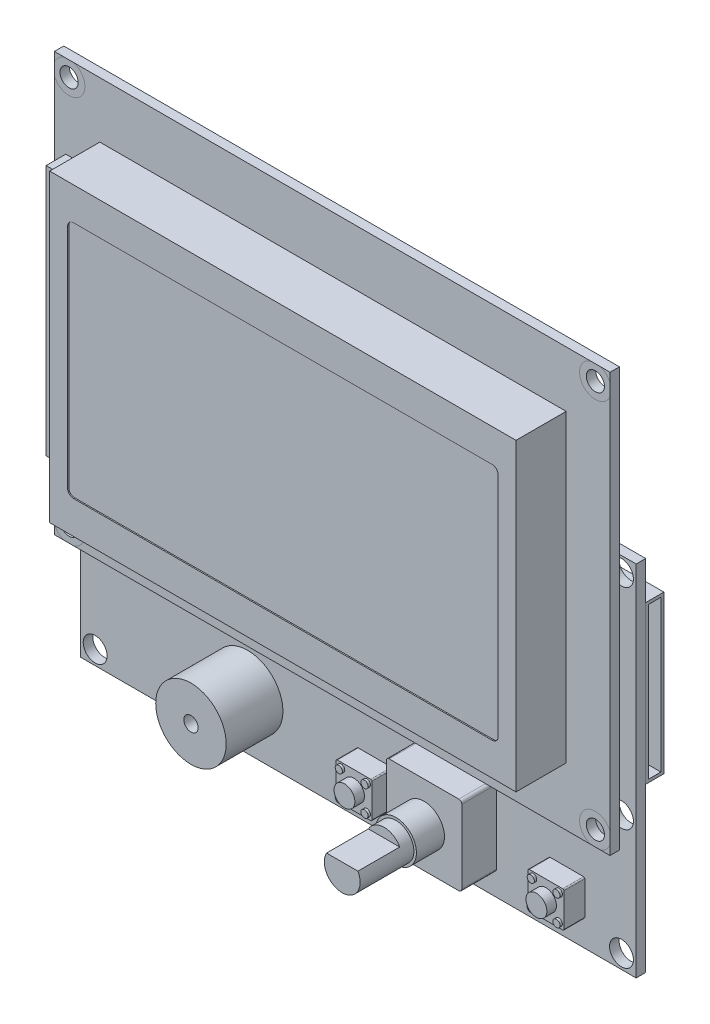
from build123d import *
from build123d.topology import SkipClean

# Parameters (mm, degrees)
SKETCH1_W            = 93.06
SKETCH1_H            = 70.1
SKETCH1_R            = 1.525
BOSS_EXTRUDE1_DEPTH  = 1.57
SKETCH2_W            = 78.1
SKETCH2_H            = 51
BOSS_EXTRUDE2_DEPTH  = 8.4
CUT_EXTRUDE1_DEPTH   = 0.2
SKETCH4_W            = 5.7
SKETCH4_H            = 42.1
BOSS_EXTRUDE3_DEPTH  = 3.3
SKETCH6_W            = 93.06
SKETCH6_H            = 60.05
BOSS_EXTRUDE4_DEPTH  = 1.6
SKETCH7_R            = 2
CUT_EXTRUDE2_DEPTH   = 1.6
BOSS_EXTRUDE5_REACH  = 118.934
SKETCH8_W            = 73.06
SKETCH8_H            = 2
SKETCH9_W            = 20.3
SKETCH9_H            = 8.75
SKETCH9_W_2          = 19.3
SKETCH9_H_2          = 7.75
BOSS_EXTRUDE6_DEPTH  = 9
BOSS_EXTRUDE7_DEPTH  = 3.05
CUT_EXTRUDE3_REACH   = 119.276
SKETCH11_W           = 2.05
SKETCH11_H           = 25.35
BOSS_EXTRUDE8_DEPTH  = 3.05
BOSS_EXTRUDE9_DEPTH  = 3.5
SKETCH15_R           = 1.75
BOSS_EXTRUDE10_DEPTH = 1.6
BOSS_EXTRUDE11_DEPTH = 5.8
SKETCH17_R           = 3.425
BOSS_EXTRUDE12_DEPTH = 4.7
BOSS_EXTRUDE13_DEPTH = 9
SKETCH19_R           = 0.6
BOSS_EXTRUDE14_DEPTH = 0.4
SKETCH21_R           = 5.9
BOSS_EXTRUDE15_DEPTH = 9.5
SKETCH22_R           = 1.2
CUT_EXTRUDE4_DEPTH   = 2
SKETCH23_R           = 3
BOSS_EXTRUDE16_DEPTH = 2


with BuildPart() as part:
    # Sketch1 → Boss-Extrude1 (new body)
    with BuildSketch(Plane.XY):
        with Locations((46.53, 35.05)):
            Rectangle(SKETCH1_W, SKETCH1_H)
        with Locations((2.455, 67.565)):
            Circle(SKETCH1_R, mode=Mode.SUBTRACT)
        with Locations((90.605, 67.565)):
            Circle(SKETCH1_R, mode=Mode.SUBTRACT)
        with Locations((90.605, 2.535)):
            Circle(SKETCH1_R, mode=Mode.SUBTRACT)
        with Locations((2.455, 2.535)):
            Circle(SKETCH1_R, mode=Mode.SUBTRACT)
    extrude(amount=BOSS_EXTRUDE1_DEPTH)

    # Sketch2 → Boss-Extrude2 (add)
    with BuildSketch(Plane.XY.offset(1.57)):
        with Locations((46.66, 35.25)):
            Rectangle(SKETCH2_W, SKETCH2_H)
    extrude(amount=BOSS_EXTRUDE2_DEPTH)

    # Sketch3 → Cut-Extrude1 (cut)
    with BuildSketch(Plane.XY.offset(9.97)):
        with BuildLine():
            Line((11.61, 55.25), (81.71, 55.25))
            ThreePointArc((81.71, 55.25), (82.417106781, 54.957106781), (82.71, 54.25))
            Line((82.71, 54.25), (82.71, 16.25))
            ThreePointArc((82.71, 16.25), (82.417106781, 15.542893219), (81.71, 15.25))
            Line((81.71, 15.25), (11.61, 15.25))
            ThreePointArc((11.61, 15.25), (10.902893219, 15.542893219), (10.61, 16.25))
            Line((10.61, 16.25), (10.61, 54.25))
            ThreePointArc((10.61, 54.25), (10.902893219, 54.957106781), (11.61, 55.25))
        make_face()
    extrude(amount=-CUT_EXTRUDE1_DEPTH, mode=Mode.SUBTRACT)

    # Sketch4 → Boss-Extrude3 (add)
    with BuildSketch(Plane.XY.offset(1.57)):
        with Locations((4.76, 35.1)):
            Rectangle(SKETCH4_W, SKETCH4_H)
    extrude(amount=BOSS_EXTRUDE3_DEPTH)


with BuildPart() as body_2:
    # Sketch6 → Boss-Extrude4 (new body)
    with BuildSketch(Plane(origin=(0, 0, -2.8), x_dir=(-1, 0, 0), z_dir=(0, 0, -1))):
        with Locations((-46.53, 10.075)):
            Rectangle(SKETCH6_W, SKETCH6_H)
    extrude(amount=BOSS_EXTRUDE4_DEPTH)

    # Sketch7 → Cut-Extrude2 (cut)
    with BuildSketch(Plane(origin=(0, 0, -4.4), x_dir=(-1, 0, 0), z_dir=(0, 0, -1))):
        with Locations((-90.605, 37.685)):
            Circle(SKETCH7_R)
        with Locations((-90.605, -17.565)):
            Circle(SKETCH7_R)
        with Locations((-2.455, -17.565)):
            Circle(SKETCH7_R)
        with Locations((-2.455, 37.685)):
            Circle(SKETCH7_R)
        with Locations((-90.605, 2.535)):
            Circle(SKETCH7_R)
        with Locations((-2.455, 2.535)):
            Circle(SKETCH7_R)
    extrude(amount=-CUT_EXTRUDE2_DEPTH, mode=Mode.SUBTRACT)

    # Sketch8 → Boss-Extrude5 (add, up to next)
    with BuildSketch(Plane(origin=(0, 0, 0), x_dir=(-1, 0, 0), z_dir=(0, 0, -1)), mode=Mode.PRIVATE) as boss_extrude5_sk1:
        with Locations((-46.53, 11)):
            Rectangle(SKETCH8_W, SKETCH8_H)
    boss_extrude5_tool1 = extrude(boss_extrude5_sk1.sketch, amount=BOSS_EXTRUDE5_REACH, mode=Mode.PRIVATE) - body_2.part
    # Sketch8 → Boss-Extrude5 (add, up to next)
    with BuildSketch(Plane(origin=(0, 0, 0), x_dir=(-1, 0, 0), z_dir=(0, 0, -1)), mode=Mode.PRIVATE) as boss_extrude5_sk2:
        with Locations((-46.53, 29.1)):
            Rectangle(SKETCH8_W, SKETCH8_H)
    boss_extrude5_tool2 = extrude(boss_extrude5_sk2.sketch, amount=BOSS_EXTRUDE5_REACH, mode=Mode.PRIVATE) - body_2.part

    add(part.part)  # Boss-Extrude5 merges part
    add(boss_extrude5_tool1.solids().sort_by_distance((46.53, 11, 0))[0])
    add(boss_extrude5_tool2.solids().sort_by_distance((46.53, 29.1, 0))[0])

    # Sketch9 → Boss-Extrude6 (add)
    # profile 1 of 2: a face of its own
    with BuildSketch(Plane(origin=(0, 0, -4.4), x_dir=(-1, 0, 0), z_dir=(0, 0, -1))):
        with Locations((-37.65, 34.075)):
            Rectangle(SKETCH9_W, SKETCH9_H)
        with Locations((-37.65, 34.075)):
            Rectangle(SKETCH9_W_2, SKETCH9_H_2, mode=Mode.SUBTRACT)
    # profile 2 of 2: a face of its own
    with BuildSketch(Plane(origin=(0, 0, -4.4), x_dir=(-1, 0, 0), z_dir=(0, 0, -1))):
        with Locations((-16.65, 34.075)):
            Rectangle(SKETCH9_W, SKETCH9_H)
        with Locations((-16.65, 34.075)):
            Rectangle(SKETCH9_W_2, SKETCH9_H_2, mode=Mode.SUBTRACT)
    extrude(amount=BOSS_EXTRUDE6_DEPTH)

    # Sketch10 → Boss-Extrude7 (add)
    with BuildSketch(Plane(origin=(0, 0, -4.4), x_dir=(-1, 0, 0), z_dir=(0, 0, -1))):
        Polygon((-93.06, 33.7), (-66.46, 33.7), (-66.46, 9.35), (-71.86, 9.35), (-75.06, 7.35), (-93.06, 7.35), align=None)
    extrude(amount=BOSS_EXTRUDE7_DEPTH)

    # Sketch11 → Cut-Extrude3 (cut, up to next)
    with BuildSketch(Plane(origin=(93.06, 0, 0), x_dir=(0, 0, -1), z_dir=(1, 0, 0)), mode=Mode.PRIVATE) as cut_extrude3_sk1:
        with Locations((5.925, 20.525)):
            Rectangle(SKETCH11_W, SKETCH11_H)
    cut_extrude3_tool1 = extrude(cut_extrude3_sk1.sketch, amount=-CUT_EXTRUDE3_REACH, mode=Mode.PRIVATE) & body_2.part
    add(cut_extrude3_tool1.solids().sort_by_distance((93.06, 20.525, -5.925))[0], mode=Mode.SUBTRACT)

    # Sketch12 → Boss-Extrude8 (add)
    with BuildSketch(Plane(origin=(0, 0, -7.45), x_dir=(-1, 0, 0), z_dir=(0, 0, -1))):
        Polygon((-75.06, 7.35), (-71.86, 9.35), (-66.46, 9.35), (-66.46, 33.7), (-66.96, 33.7), (-66.96, 9.85), (-72.003398113, 9.85), (-75.203398113, 7.85), (-77.778406171, 7.85), (-77.778406171, 7.35), align=None)
    extrude(amount=-BOSS_EXTRUDE8_DEPTH)

    # Sketch14 → Boss-Extrude9 (add)
    with BuildSketch(Plane.XY.offset(-2.8)):
        with BuildLine():
            Line((78.66, -9.65), (84.26, -9.65))
            ThreePointArc((84.26, -9.65), (84.401421356, -9.708578644), (84.46, -9.85))
            Line((84.46, -9.85), (84.46, -15.45))
            ThreePointArc((84.46, -15.45), (84.401421356, -15.591421356), (84.26, -15.65))
            Line((84.26, -15.65), (78.66, -15.65))
            ThreePointArc((78.66, -15.65), (78.518578644, -15.591421356), (78.46, -15.45))
            Line((78.46, -15.45), (78.46, -9.85))
            ThreePointArc((78.46, -9.85), (78.518578644, -9.708578644), (78.66, -9.65))
        make_face()
        with BuildLine():
            Line((46.51, -9.85), (52.11, -9.85))
            ThreePointArc((52.11, -9.85), (52.251421356, -9.908578644), (52.31, -10.05))
            Line((52.31, -10.05), (52.31, -15.65))
            ThreePointArc((52.31, -15.65), (52.251421356, -15.791421356), (52.11, -15.85))
            Line((52.11, -15.85), (46.51, -15.85))
            ThreePointArc((46.51, -15.85), (46.368578644, -15.791421356), (46.31, -15.65))
            Line((46.31, -15.65), (46.31, -10.05))
            ThreePointArc((46.31, -10.05), (46.368578644, -9.908578644), (46.51, -9.85))
        make_face()
    extrude(amount=BOSS_EXTRUDE9_DEPTH)

    # Sketch15 → Boss-Extrude10 (add)
    with BuildSketch(Plane.XY.offset(0.7)):
        with Locations((49.31, -12.85)):
            Circle(SKETCH15_R)
        with Locations((81.46, -12.65)):
            Circle(SKETCH15_R)
    extrude(amount=BOSS_EXTRUDE10_DEPTH)

    # Sketch16 → Boss-Extrude11 (add)
    with BuildSketch(Plane.XY.offset(-2.8)):
        with BuildLine():
            Line((57.51, -3.05), (69.16, -3.05))
            ThreePointArc((69.16, -3.05), (69.513553391, -3.196446609), (69.66, -3.55))
            Line((69.66, -3.55), (69.66, -15.85))
            ThreePointArc((69.66, -15.85), (69.513553391, -16.203553391), (69.16, -16.35))
            Line((69.16, -16.35), (57.51, -16.35))
            ThreePointArc((57.51, -16.35), (57.156446609, -16.203553391), (57.01, -15.85))
            Line((57.01, -15.85), (57.01, -3.55))
            ThreePointArc((57.01, -3.55), (57.156446609, -3.196446609), (57.51, -3.05))
        make_face()
    extrude(amount=BOSS_EXTRUDE11_DEPTH)

    # Sketch17 → Boss-Extrude12 (add)
    with BuildSketch(Plane.XY.offset(3)):
        with Locations((63.335, -9.7)):
            Circle(SKETCH17_R)
    extrude(amount=BOSS_EXTRUDE12_DEPTH)

    # Sketch18 → Boss-Extrude13 (add)
    with BuildSketch(Plane.XY.offset(7.7)):
        with BuildLine():
            Line((60.708690803, -8.25), (65.961309197, -8.25))
            ThreePointArc((65.961309197, -8.25), (63.335, -12.7), (60.708690803, -8.25))
        make_face()
    extrude(amount=BOSS_EXTRUDE13_DEPTH)

    # Sketch19 → Boss-Extrude14 (add)
    with BuildSketch(Plane.XY.offset(0.7)):
        with Locations((79.31, -10.5)):
            Circle(SKETCH19_R)
        with Locations((83.61, -10.5)):
            Circle(SKETCH19_R)
        with Locations((83.61, -14.8)):
            Circle(SKETCH19_R)
        with Locations((79.31, -14.8)):
            Circle(SKETCH19_R)
        with Locations((47.16, -10.7)):
            Circle(SKETCH19_R)
        with Locations((51.46, -10.7)):
            Circle(SKETCH19_R)
        with Locations((51.46, -15)):
            Circle(SKETCH19_R)
        with Locations((47.16, -15)):
            Circle(SKETCH19_R)
    extrude(amount=BOSS_EXTRUDE14_DEPTH)

    # Sketch21 → Boss-Extrude15 (add)
    with BuildSketch(Plane.XY.offset(-2.8)):
        with Locations((28, -10.85)):
            Circle(SKETCH21_R)
    extrude(amount=BOSS_EXTRUDE15_DEPTH)

    # Sketch22 → Cut-Extrude4 (cut)
    with BuildSketch(Plane.XY.offset(6.7)):
        with Locations((28, -10.85)):
            Circle(SKETCH22_R)
    extrude(amount=-CUT_EXTRUDE4_DEPTH, mode=Mode.SUBTRACT)

    # Sketch23 → Boss-Extrude16 (add)
    with SkipClean():  # the faces are left unmerged after this step: merging them gives an invalid solid
        with BuildSketch(Plane.XY.offset(7.7)):
            with Locations((63.335, -9.7)):
                Circle(SKETCH23_R)
        extrude(amount=BOSS_EXTRUDE16_DEPTH)


solid = body_2.part
